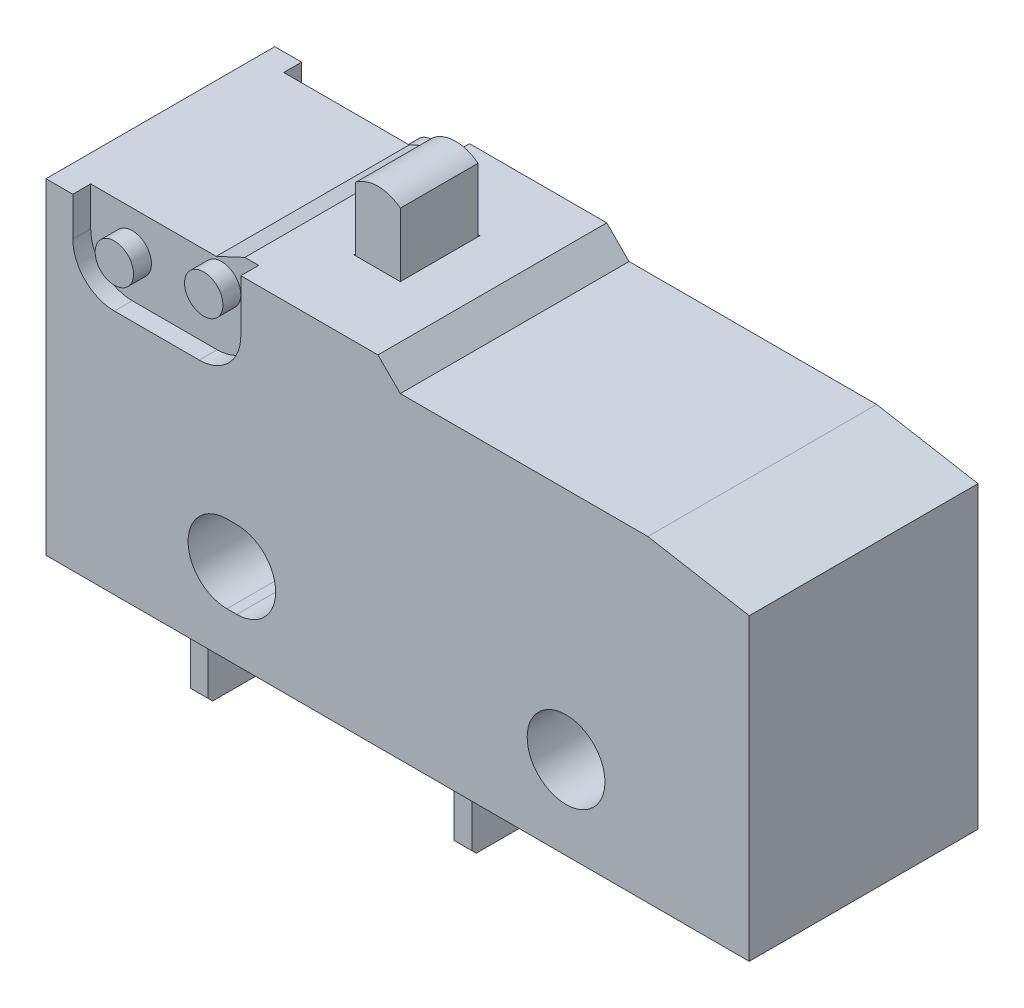
from build123d import *

# Parameters (mm, degrees)
SKETCH2_R          = 1.1049
EXTRUDE1_DEPTH     = 3.2512
EXTRUDE2_DEPTH     = 1.1049
SKETCH4_W          = 1.3208
SKETCH4_H          = 2.2606
CUT_EXTRUDE1_DEPTH = 1.016
SKETCH5_R          = 0.5461
CUT_EXTRUDE2_DEPTH = 0.508
SKETCH10_R         = 0.9017
EXTRUDE6_DEPTH     = 0.254
LPATTERN1_COUNT    = 2
LPATTERN1_PITCH    = 7.493


with BuildPart() as part:
    # Sketch2 → Extrude1 (new, symmetric)
    with BuildSketch(Plane.XY):
        Polygon((9.9949, 8.509), (7.113888836, 9.017), (0.0762, 9.017), (-0.5588, 9.652), (-4.8514, 9.652), (-5.664596778, 9.271), (-9.9949, 9.271), (-9.9949, 0), (9.9949, 0), align=None)
        with Locations((4.7879, 2.3622)):
            Circle(SKETCH2_R, mode=Mode.SUBTRACT)
        with BuildLine():
            Line((-4.8514, 3.4671), (-4.572, 3.4671))
            ThreePointArc((-4.572, 3.4671), (-3.4671, 2.3622), (-4.572, 1.2573))
            Line((-4.572, 1.2573), (-4.8514, 1.2573))
            ThreePointArc((-4.8514, 1.2573), (-5.9563, 2.3622), (-4.8514, 3.4671))
        make_face(mode=Mode.SUBTRACT)
    extrude(amount=EXTRUDE1_DEPTH, both=True)

    # Sketch4 → Cut-Extrude1 (cut)
    with BuildSketch(Plane(origin=(0, 9.652, 0), x_dir=(-1, 0, 0), z_dir=(0, 1, 0))):
        with Locations((2.7051, 0)):
            Rectangle(SKETCH4_W, SKETCH4_H)
    extrude(amount=-CUT_EXTRUDE1_DEPTH, mode=Mode.SUBTRACT)

    # Sketch5 → Cut-Extrude2 (cut)
    with BuildSketch(Plane.XY.offset(3.2512)):
        with BuildLine():
            Line((-9.2329, 9.271), (-9.2329, 8.1661))
            ThreePointArc((-9.2329, 8.1661), (-8.886963819, 7.330936181), (-8.0518, 6.985))
            Line((-8.0518, 6.985), (-5.6388, 6.985))
            ThreePointArc((-5.6388, 6.985), (-4.803636181, 7.330936181), (-4.4577, 8.1661))
            Line((-4.4577, 8.1661), (-4.4577, 9.652))
            Line((-4.4577, 9.652), (-4.8514, 9.652))
            Line((-4.8514, 9.652), (-5.664596778, 9.271))
            Line((-5.664596778, 9.271), (-9.2329, 9.271))
        make_face()
        with Locations((-5.5118, 8.6741)):
            Circle(SKETCH5_R, mode=Mode.SUBTRACT)
        with Locations((-8.0518, 8.1661)):
            Circle(SKETCH5_R, mode=Mode.SUBTRACT)
    cut_extrude2 = extrude(amount=-CUT_EXTRUDE2_DEPTH, mode=Mode.SUBTRACT)

    # Mirror1: Cut-Extrude2 across plane
    add(cut_extrude2.mirror(Plane.XY), mode=Mode.SUBTRACT)

    # Sketch10 → Extrude6 (add, symmetric)
    with BuildSketch(Plane(origin=(-7.493, 0, 0), x_dir=(0, 0, -1), z_dir=(1, 0, 0))):
        Polygon((-1.397, 0), (-1.397, -3.0734), (-1.27, -3.2004), (1.27, -3.2004), (1.397, -3.0734), (1.397, 0), align=None)
        with Locations((0, -1.7018)):
            Circle(SKETCH10_R, mode=Mode.SUBTRACT)
    extrude6 = extrude(amount=EXTRUDE6_DEPTH, both=True)

    # LPattern1: Extrude6 ×2
    with Locations(*[(i * LPATTERN1_PITCH, 0, 0) for i in range(1, LPATTERN1_COUNT)]):
        add(extrude6)


with BuildPart() as body_2:
    # Sketch3 → Extrude2 (new, symmetric)
    with BuildSketch(Plane.XY):
        with BuildLine():
            Line((-3.3401, 9.271), (-3.3401, 11.435714746))
            ThreePointArc((-3.3401, 11.435714746), (-2.7051, 11.6586), (-2.0701, 11.435714746))
            Line((-2.0701, 11.435714746), (-2.0701, 9.271))
            Line((-2.0701, 9.271), (-3.3401, 9.271))
        make_face()
    extrude(amount=EXTRUDE2_DEPTH, both=True)


solid = Compound([part.part, body_2.part])
